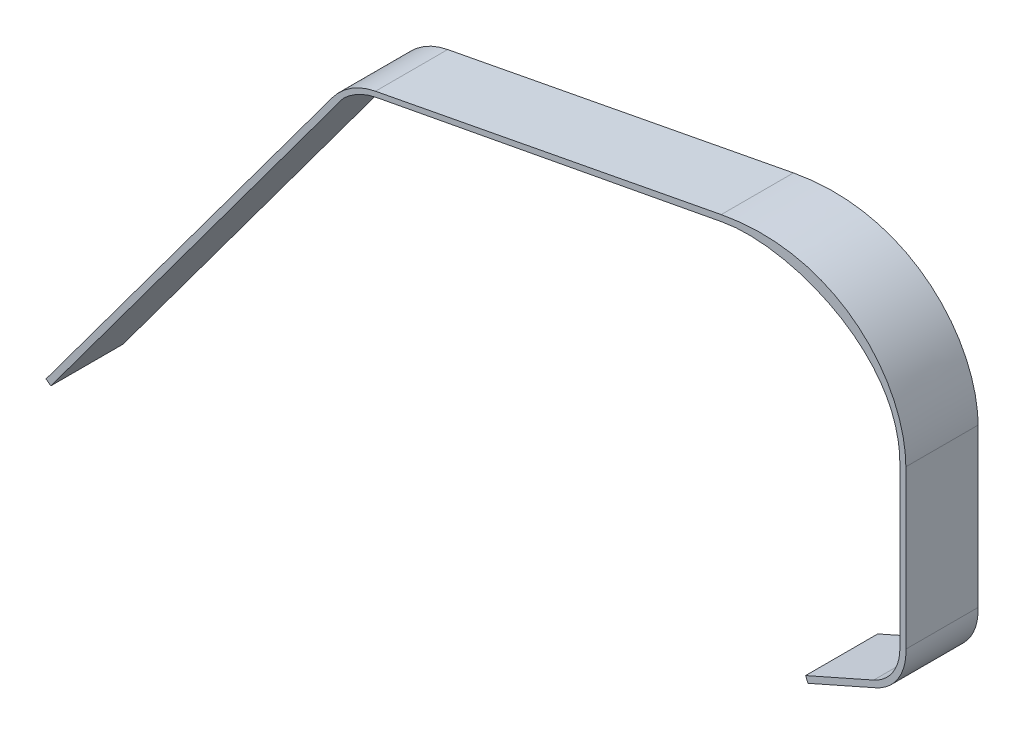
from build123d import *

# Parameters (mm, degrees)
BOSS_EXTRUDE1_DEPTH = 38.1


with BuildPart() as part:
    # Sketch1 → Boss-Extrude1 (new body)
    with BuildSketch(Plane.XY):
        with BuildLine():
            Line((175.541804332, 71.16361528), (-6.935300935, 36.310776905))
            ThreePointArc((-6.935300935, 36.310776905), (-19.672190435, 31.298176336), (-29.712056517, 21.994649713))
            Line((-29.712056517, 21.994649713), (-180.836487688, -182.155800454))
            Line((-180.836487688, -182.155800454), (-178.284607061, -184.044855844))
            Line((-178.284607061, -184.044855844), (-23.978021166, 24.541068371))
            ThreePointArc((-23.978021166, 24.541068371), (-15.882193155, 30.413245082), (-6.43689032, 33.701275627))
            Line((-6.43689032, 33.701275627), (176.137453427, 68.045007792))
            add(Edge.make_bspline(
                [(176.137453427, 68.045007792), (211.017706698, 74.707080977), (269.815086051, 53.37456257), (269.815086051, 4.570832291)],
                knots=[0, 0, 0, 0, 1, 1, 1, 1], degree=3))
            Line((269.815086051, 4.570832291), (269.815086051, -80.131284053))
            ThreePointArc((269.815086051, -80.131284053), (266.052343156, -92.809674375), (255.982498713, -101.38277464))
            Line((255.982498713, -101.38277464), (220.049833657, -117.290804222))
            Line((220.049833657, -117.290804222), (221.335135933, -120.194013318))
            Line((221.335135933, -120.194013318), (257.26780099, -104.285983736))
            ThreePointArc((257.26780099, -104.285983736), (269.076717525, -93.967346814), (272.955117371, -78.772519))
            Line((272.955117371, -78.772519), (272.955117371, 4.570832291))
            add(Edge.make_bspline(
                [(175.541804332, 71.16361528), (238.006944803, 83.094358272), (272.955117371, 41.683405181), (272.955117371, 4.570832291)],
                knots=[0, 0, 0, 0, 1, 1, 1, 1], degree=3))
        make_face()
    extrude(amount=BOSS_EXTRUDE1_DEPTH)


solid = part.part
